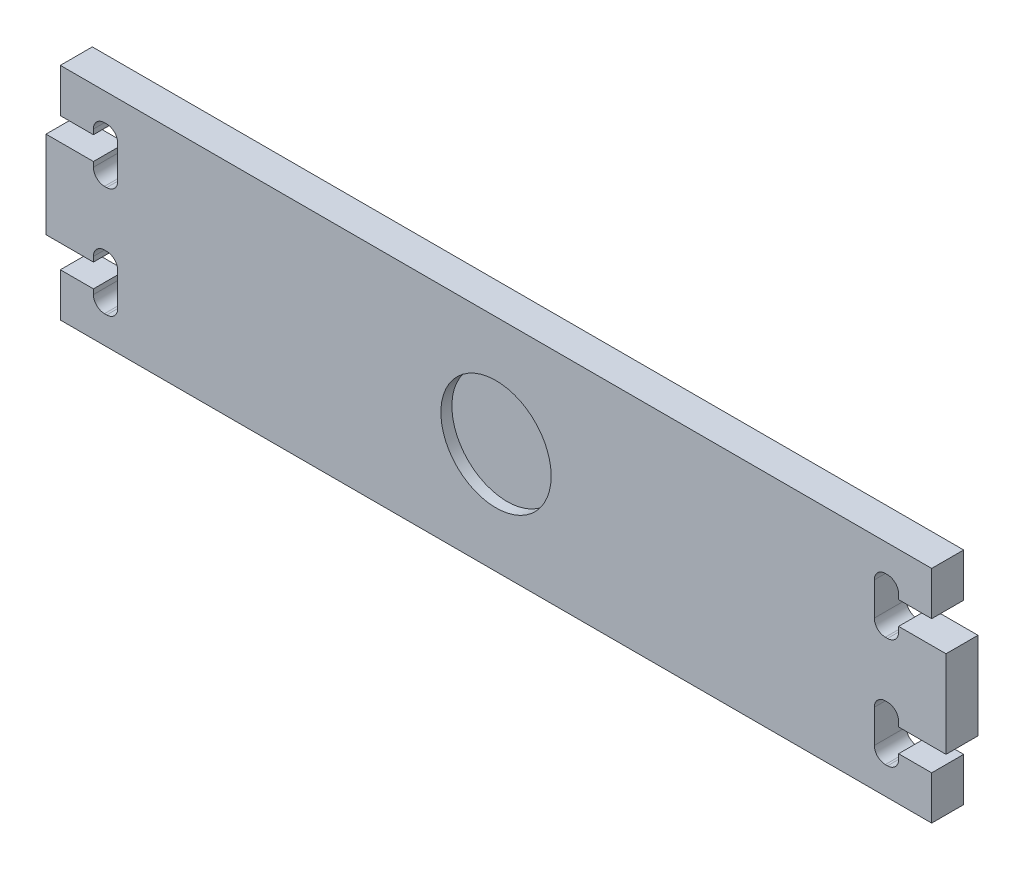
from build123d import *

# Parameters (mm, degrees)
BASE_SHAPE_DEPTH       = 2.9
SKETCH2_R              = 5
FORWARD_CUT_TEMP_DEPTH = 1
FILLET1_R              = 1


with BuildPart() as part:
    # Sketch1 → Base shape (new body)
    with BuildSketch(Plane.XY):
        Polygon((39.5, 10), (-39.5, 10), (-39.5, 6.05), (-36.5, 6.05), (-36.5, 7.5), (-34.3, 7.5), (-34.3, 2.5), (-36.5, 2.5), (-36.5, 3.95), (-40.8, 3.95), (-40.8, -3.95), (-36.5, -3.95), (-36.5, -2.5), (-34.3, -2.5), (-34.3, -7.5), (-36.5, -7.5), (-36.5, -6.05), (-39.5, -6.05), (-39.5, -10), (39.5, -10), (39.5, -6.05), (36.5, -6.05), (36.5, -7.5), (34.3, -7.5), (34.3, -2.5), (36.5, -2.5), (36.5, -3.95), (40.8, -3.95), (40.8, 3.95), (36.5, 3.95), (36.5, 2.5), (34.3, 2.5), (34.3, 7.5), (36.5, 7.5), (36.5, 6.05), (39.5, 6.05), align=None)
    extrude(amount=BASE_SHAPE_DEPTH)

    # Sketch2 → Forward cut (temp) (cut)
    with BuildSketch(Plane.XY.offset(2.9)):
        Circle(SKETCH2_R)
    extrude(amount=-FORWARD_CUT_TEMP_DEPTH, mode=Mode.SUBTRACT)

    # Fillet1
    fillet1_edges = [part.edges().sort_by_distance(p)[0] for p in [
        (36.5, -7.5, 1.45),
        (36.5, 2.5, 1.45),
        (34.3, 2.5, 1.45),
        (34.3, -7.5, 1.45),
        (36.5, -2.5, 1.45),
        (36.5, 7.5, 1.45),
        (34.3, -2.5, 1.45),
        (34.3, 7.5, 1.45),
        (-36.5, -2.5, 1.45),
        (-34.3, -2.5, 1.45),
        (-34.3, -7.5, 1.45),
        (-36.5, -7.5, 1.45),
        (-36.5, 2.5, 1.45),
        (-34.3, 2.5, 1.45),
        (-34.3, 7.5, 1.45),
        (-36.5, 7.5, 1.45),
    ]]
    fillet(fillet1_edges, radius=FILLET1_R)


solid = part.part
